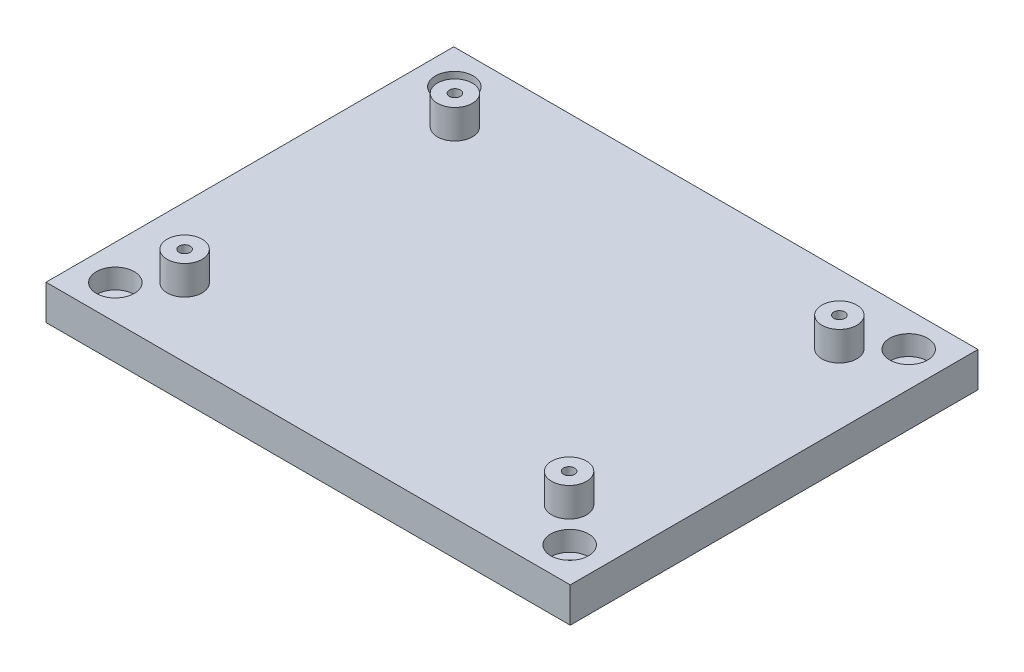
from build123d import *

# Parameters (mm, degrees)
SZKIC1_W                                            = 90
SZKIC1_H                                            = 70
DODANIE_WYCI_GNI_CIE1_DEPTH                         = 6
SZKIC2_R                                            = 3
SZKIC2_R_2                                          = 0.95
DODANIE_WYCI_GNI_CIE2_DEPTH                         = 5
CBORE_FOR_M3_HEX_SOCKET_HEAD_CAP_SCREW1_D           = 3.2
CBORE_FOR_M3_HEX_SOCKET_HEAD_CAP_SCREW1_DEPTH       = 17.7
CBORE_FOR_M3_HEX_SOCKET_HEAD_CAP_SCREW1_CBORE_D     = 6.5
CBORE_FOR_M3_HEX_SOCKET_HEAD_CAP_SCREW1_CBORE_DEPTH = 3.4
CBORE_FOR_M3_HEX_SOCKET_HEAD_CAP_SCREW1_TIP         = 0.96137699


with BuildPart() as part:
    # Szkic1 → Dodanie-wyciągnięcie1 (new body)
    with BuildSketch(Plane(origin=(0, 0, 0), x_dir=(1, 0, 0), z_dir=(0, 1, 0))):
        Rectangle(SZKIC1_W, SZKIC1_H)
    extrude(amount=DODANIE_WYCI_GNI_CIE1_DEPTH)

    # Szkic2 → Dodanie-wyciągnięcie2 (add)
    # profile 1 of 4: a face of its own
    with BuildSketch(Plane(origin=(0, 6, 0), x_dir=(1, 0, 0), z_dir=(0, 1, 0))):
        with Locations((-33, 23.2)):
            Circle(SZKIC2_R)
        with Locations((-33, 23.2)):
            Circle(SZKIC2_R_2, mode=Mode.SUBTRACT)
    # profile 2 of 4: a face of its own
    with BuildSketch(Plane(origin=(0, 6, 0), x_dir=(1, 0, 0), z_dir=(0, 1, 0))):
        with Locations((-33, -23.2)):
            Circle(SZKIC2_R)
        with Locations((-33, -23.2)):
            Circle(SZKIC2_R_2, mode=Mode.SUBTRACT)
    # profile 3 of 4: a face of its own
    with BuildSketch(Plane(origin=(0, 6, 0), x_dir=(1, 0, 0), z_dir=(0, 1, 0))):
        with Locations((33, -23.2)):
            Circle(SZKIC2_R)
        with Locations((33, -23.2)):
            Circle(SZKIC2_R_2, mode=Mode.SUBTRACT)
    # profile 4 of 4: a face of its own
    with BuildSketch(Plane(origin=(0, 6, 0), x_dir=(1, 0, 0), z_dir=(0, 1, 0))):
        with Locations((33, 23.2)):
            Circle(SZKIC2_R)
        with Locations((33, 23.2)):
            Circle(SZKIC2_R_2, mode=Mode.SUBTRACT)
    extrude(amount=DODANIE_WYCI_GNI_CIE2_DEPTH)

    # CBORE for M3 Hex Socket Head Cap Screw1
    with Locations(Plane(origin=(0, 6, 0), x_dir=(1, 0, 0), z_dir=(0, 1, 0))):
        with Locations((-39, 29.1), (-39, -29.1), (39, 29.1), (39, -29.1)):
            CounterBoreHole(CBORE_FOR_M3_HEX_SOCKET_HEAD_CAP_SCREW1_D / 2, CBORE_FOR_M3_HEX_SOCKET_HEAD_CAP_SCREW1_CBORE_D / 2, CBORE_FOR_M3_HEX_SOCKET_HEAD_CAP_SCREW1_CBORE_DEPTH, depth=CBORE_FOR_M3_HEX_SOCKET_HEAD_CAP_SCREW1_DEPTH)
            with Locations((0, 0, -(CBORE_FOR_M3_HEX_SOCKET_HEAD_CAP_SCREW1_DEPTH + CBORE_FOR_M3_HEX_SOCKET_HEAD_CAP_SCREW1_TIP / 2))):  # 118° drill point
                Cone(0, CBORE_FOR_M3_HEX_SOCKET_HEAD_CAP_SCREW1_D / 2, CBORE_FOR_M3_HEX_SOCKET_HEAD_CAP_SCREW1_TIP, mode=Mode.SUBTRACT)


solid = part.part
